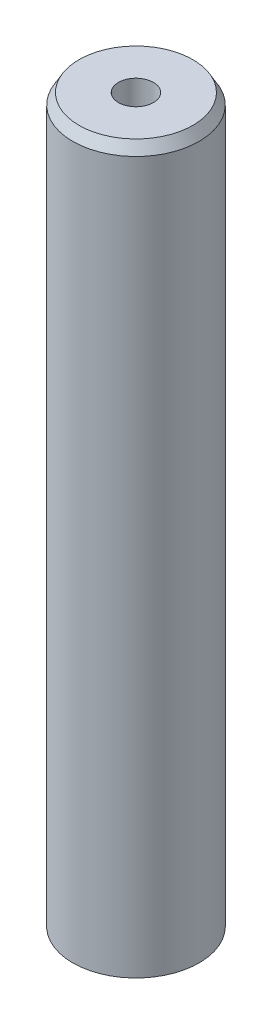
from build123d import *
from OCP.BRepFilletAPI import BRepFilletAPI_MakeChamfer

# Parameters (mm, degrees)
SKETCH1_R           = 7.5
BOSS_EXTRUDE1_DEPTH = 86.488269481
SKETCH2_R           = 2.079244207
CUT_EXTRUDE1_DEPTH  = 88.136219552
CHAMFER1_SIZE       = 1.280793501
CHAMFER1_SIZE2      = 0.739466472


with BuildPart() as part:
    # Sketch1 → Boss-Extrude1 (new body)
    with BuildSketch(Plane(origin=(0, 0, 0), x_dir=(1, 0, 0), z_dir=(0, 1, 0))):
        Circle(SKETCH1_R)
    extrude(amount=BOSS_EXTRUDE1_DEPTH)

    # Sketch2 → Cut-Extrude1 (cut, through all)
    with BuildSketch(Plane(origin=(0, 0, 0), x_dir=(1, 0, 0), z_dir=(0, 1, 0))):
        Circle(SKETCH2_R)
    extrude(amount=CUT_EXTRUDE1_DEPTH, mode=Mode.SUBTRACT)

    # Chamfer1: one chamfer whose edges measure the first distance from different faces: ONE call of the kernel's chamfer builder (chamfer() names one face for all edges)
    chamfer1_edges_1 = [part.edges().sort_by_distance(p)[0] for p in [
        (-7.5, 86.488269481, 0),
    ]]
    chamfer1_side_1 = [part.faces().sort_by_distance(p)[0] for p in [
        (-7.5, 43.244134741, 0),
    ]]
    chamfer1_edges_2 = [part.edges().sort_by_distance(p)[0] for p in [
        (-7.5, 0, 0),
    ]]
    chamfer1_side_2 = [part.faces().sort_by_distance(p)[0] for p in [
        (-7.287867966, 0, 0),
    ]]
    chamfer1 = BRepFilletAPI_MakeChamfer(part.part.solid().wrapped)
    for e in chamfer1_edges_1:
        chamfer1.Add(CHAMFER1_SIZE, CHAMFER1_SIZE2, e.wrapped, chamfer1_side_1[0].wrapped)  # the first distance lies on this face
    for e in chamfer1_edges_2:
        chamfer1.Add(CHAMFER1_SIZE, CHAMFER1_SIZE2, e.wrapped, chamfer1_side_2[0].wrapped)  # the first distance lies on this face
    add(Compound.cast(chamfer1.Shape()), mode=Mode.REPLACE)


solid = part.part
